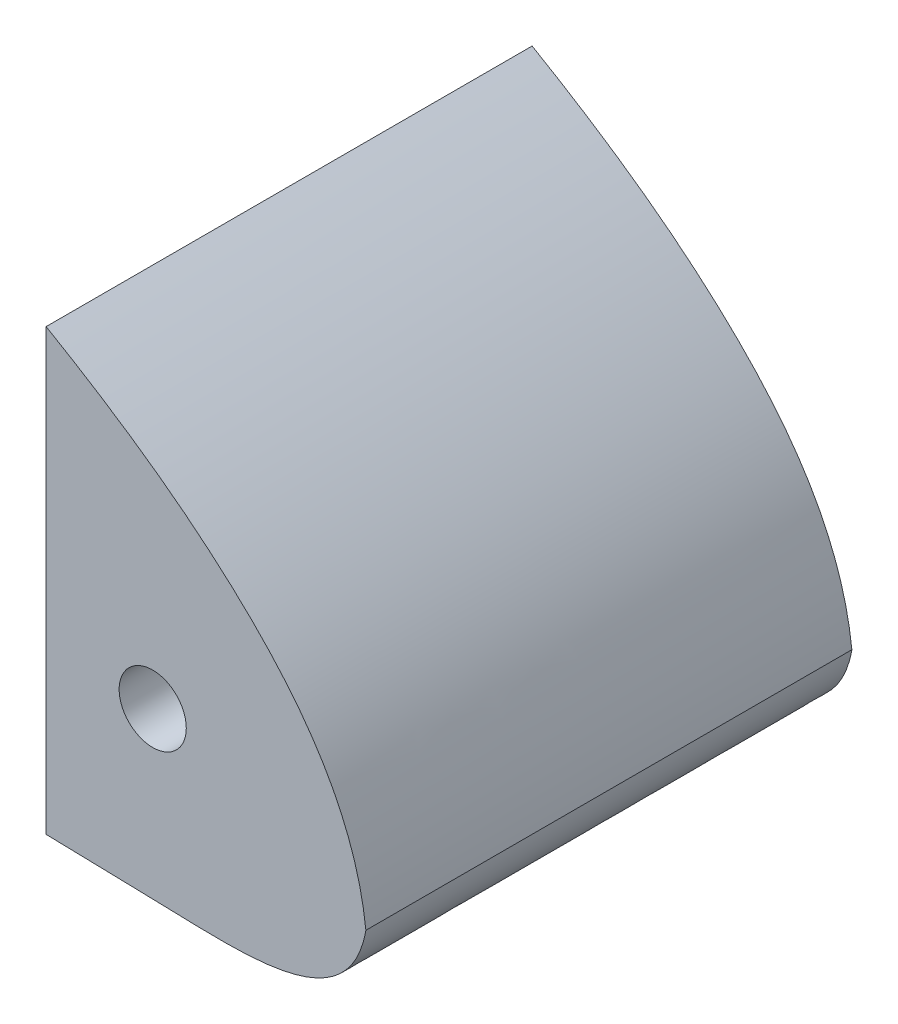
from build123d import *

# Parameters (mm, degrees)
SKETCH1_R           = 2
SKETCH1_R_2         = 2.127
BOSS_EXTRUDE1_DEPTH = 28.956
SKETCH2_W           = 134.292636257
SKETCH2_H           = 53.36276468
CUT_EXTRUDE1_DEPTH  = 28.956


with BuildPart() as part:
    # Sketch1 → Boss-Extrude1 (new body)
    with BuildSketch(Plane.XY):
        with BuildLine():
            Line((-66.006971629, 14.952323969), (-66.006971629, -5.634708623))
            add(Edge.make_bspline(
                [(-66.006971629, -5.634708623), (-44.594037188, -5.53917688), (-13.013022308, -6.724098502), (26.136656569, -12.750856754), (48.765267423, -16.900764204), (64.683362663, -16.969052393), (75.290630493, -17.522529218), (76.216996263, -12.308293591)],
                knots=[0.133250972, 0.133250972, 0.133250972, 0.133250972, 0.517329722, 0.696666541, 0.849409938, 0.919519723, 1, 1, 1, 1], degree=3))
            add(Edge.make_bspline(
                [(76.216996263, -12.308293591), (75.606952539, -6.766559658), (69.704300689, 1.138389205), (56.422236631, 10.264383598), (36.976103105, 19.370772836), (8.741687209, 24.815403957), (-27.455234983, 23.566672909), (-52.387628688, 18.103631651), (-66.006971629, 14.952323969)],
                knots=[0, 0, 0, 0, 0.086586993, 0.161737428, 0.268322265, 0.445156627, 0.638028873, 0.872370876, 0.872370876, 0.872370876, 0.872370876], degree=3))
        make_face()
        with Locations((63.516996263, -7.228293591)):
            Circle(SKETCH1_R, mode=Mode.SUBTRACT)
        with Locations((-25.383003737, 13.091706409)):
            Circle(SKETCH1_R_2, mode=Mode.SUBTRACT)
    extrude(amount=BOSS_EXTRUDE1_DEPTH)

    # Sketch2 → Cut-Extrude1 (cut)
    with BuildSketch(Plane.XY.offset(28.956)):
        with Locations((-9.979321866, 4.011118028)):
            Rectangle(SKETCH2_W, SKETCH2_H)
    extrude(amount=-CUT_EXTRUDE1_DEPTH, mode=Mode.SUBTRACT)


solid = part.part
